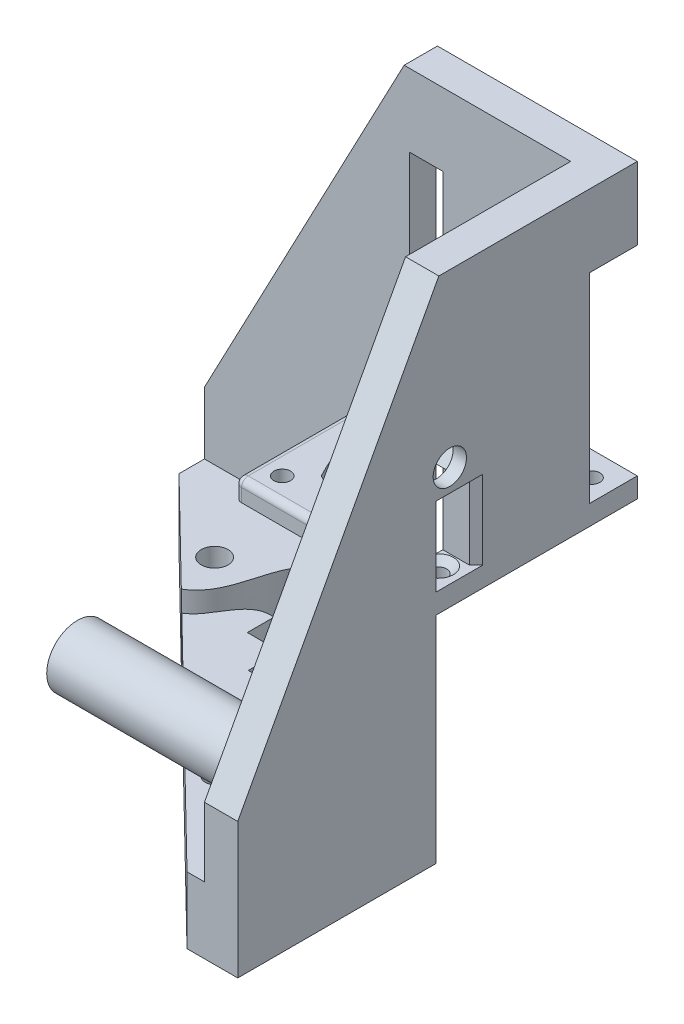
from build123d import *

# Parameters (mm, degrees)
SKETCH1_R                      = 1.560106864
SKETCH1_R_2                    = 2.009221825
BOSS_EXTRUDE1_DEPTH            = 10
BOSS_EXTRUDE3_START            = -10
BOSS_EXTRUDE3_DEPTH            = 76.2
CUT_EXTRUDE1_REACH             = 89.478
SKETCH4_W                      = 29.21
SKETCH4_H                      = 29.21
CUT_EXTRUDE1_DIRECTION_2_DEPTH = 22.3
CUT_EXTRUDE2_START             = -3
SKETCH5_W                      = 6.21
SKETCH5_H                      = 5
SKETCH5_W_2                    = 5
SKETCH5_H_2                    = 6.21
CUT_EXTRUDE2_DEPTH             = 30
CUT_EXTRUDE3_REACH             = 74.091
SKETCH6_R                      = 1.25
CHAMFER1_SIZE                  = 1
CUT_EXTRUDE4_REACH             = 102.097
CUT_EXTRUDE5_REACH             = 106.467
SKETCH9_R                      = 1.25
BOSS_EXTRUDE4_DEPTH            = 3
FILLET2_R                      = 1
SKETCH10_R                     = 11.5
CUT_EXTRUDE6_DEPTH             = 3
SKETCH12_R                     = 4.6
SKETCH12_R_2                   = 2.6
BOSS_EXTRUDE5_DEPTH            = 30
FILLET3_R                      = 1
CHAMFER2_SIZE                  = 1
BOSS_EXTRUDE6_REACH            = 109.184
SKETCH14_W                     = 12.395863616
SKETCH14_H                     = 18.726756054
SKETCH13_R                     = 2.5
CUT_EXTRUDE7_DEPTH             = 20
CUT_EXTRUDE8_DEPTH             = 3
CUT_EXTRUDE11_DEPTH            = 10
BOSS_EXTRUDE8_DEPTH            = 3


with BuildPart() as part:
    # Sketch1 → Boss-Extrude1 (new body)
    with BuildSketch(Plane(origin=(0, 0, 0), x_dir=(1, 0, 0), z_dir=(0, 1, 0))):
        Polygon((-34.466315789, 14.371052632), (-34.466315789, 5.547894737), (17.913684211, -45.628947368), (25.533684211, -45.628947368), (25.533684211, 14.371052632), align=None)
        with Locations(Location((7.652084211, -31.069547368, 0), (0, 0, 270))):
            Circle(SKETCH1_R, mode=Mode.SUBTRACT)
        with Locations(Location((-20.922915789, -2.646947368, 0), (0, 0, 270))):
            Circle(SKETCH1_R_2, mode=Mode.SUBTRACT)
    extrude(amount=BOSS_EXTRUDE1_DEPTH)

    # Sketch3 → Boss-Extrude3 (add)
    with BuildSketch(Plane(origin=(0, 10, 0), x_dir=(1, 0, 0), z_dir=(0, 1, 0)).offset(BOSS_EXTRUDE3_START)):
        Polygon((-34.466315789, 14.371052632), (-34.466315789, 9.371052632), (20.533684211, 9.371052632), (20.533684211, -45.628947368), (25.533684211, -45.628947368), (25.533684211, 14.371052632), align=None)
    extrude(amount=BOSS_EXTRUDE3_DEPTH)

    # Sketch4 → Cut-Extrude1 (cut, up to next)
    with BuildSketch(Plane(origin=(0, 10, 0), x_dir=(1, 0, 0), z_dir=(0, 1, 0)), mode=Mode.PRIVATE) as cut_extrude1_sk1:
        with Locations((10.928684211, -0.233947368)):
            Rectangle(SKETCH4_W, SKETCH4_H)
    cut_extrude1_tool1 = extrude(cut_extrude1_sk1.sketch, amount=-CUT_EXTRUDE1_REACH, mode=Mode.PRIVATE) & part.part
    add(cut_extrude1_tool1.solids().sort_by_distance((10.928684, 10, 0.233947))[0], mode=Mode.SUBTRACT)

    # Sketch4 → Cut-Extrude1 direction 2 (cut)
    with BuildSketch(Plane(origin=(0, 10, 0), x_dir=(1, 0, 0), z_dir=(0, 1, 0))):
        with Locations((10.928684211, -0.233947368)):
            Rectangle(SKETCH4_W, SKETCH4_H)
    extrude(amount=CUT_EXTRUDE1_DIRECTION_2_DEPTH, mode=Mode.SUBTRACT)

    # Sketch5 → Cut-Extrude2 (cut)
    with BuildSketch(Plane.XZ.offset(-32.3).offset(CUT_EXTRUDE2_START)):
        with Locations((22.428684211, 12.338947368)):
            Rectangle(SKETCH5_W, SKETCH5_H)
        with Locations((-1.176315789, -11.266052632)):
            Rectangle(SKETCH5_W_2, SKETCH5_H_2)
        with Locations((22.428684211, -11.266052632)):
            Rectangle(SKETCH5_W, SKETCH5_H_2)
    extrude(amount=-CUT_EXTRUDE2_DEPTH, mode=Mode.SUBTRACT)

    # Sketch6 → Cut-Extrude3 (cut, up to next)
    with BuildSketch(Plane.XZ.offset(-32.3), mode=Mode.PRIVATE) as cut_extrude3_sk1:
        with Locations(Location((22.323684211, 12.288947368, 0), (0, 0, 270))):
            Circle(SKETCH6_R)
    cut_extrude3_tool1 = extrude(cut_extrude3_sk1.sketch, amount=-CUT_EXTRUDE3_REACH, mode=Mode.PRIVATE) & part.part
    # Sketch6 → Cut-Extrude3 (cut, up to next)
    with BuildSketch(Plane.XZ.offset(-32.3), mode=Mode.PRIVATE) as cut_extrude3_sk2:
        with Locations(Location((22.323684211, -10.711052632, 0), (0, 0, 270))):
            Circle(SKETCH6_R)
    cut_extrude3_tool2 = extrude(cut_extrude3_sk2.sketch, amount=-CUT_EXTRUDE3_REACH, mode=Mode.PRIVATE) & part.part
    # Sketch6 → Cut-Extrude3 (cut, up to next)
    with BuildSketch(Plane.XZ.offset(-32.3), mode=Mode.PRIVATE) as cut_extrude3_sk3:
        with Locations(Location((-0.676315789, -10.711052632, 0), (0, 0, 270))):
            Circle(SKETCH6_R)
    cut_extrude3_tool3 = extrude(cut_extrude3_sk3.sketch, amount=-CUT_EXTRUDE3_REACH, mode=Mode.PRIVATE) & part.part
    add(cut_extrude3_tool1.solids().sort_by_distance((22.323684, 32.3, 12.288947))[0], mode=Mode.SUBTRACT)
    add(cut_extrude3_tool2.solids().sort_by_distance((22.323684, 32.3, -10.711053))[0], mode=Mode.SUBTRACT)
    add(cut_extrude3_tool3.solids().sort_by_distance((-0.676316, 32.3, -10.711053))[0], mode=Mode.SUBTRACT)

    # Chamfer1
    chamfer1_edges = [part.edges().sort_by_distance(p)[0] for p in [
        (19.323684211, 50.3, -14.371052632),
        (25.533684211, 50.3, -8.161052632),
        (-3.676315789, 50.3, -14.371052632),
        (1.323684211, 50.3, -14.371052632),
        (25.533684211, 16.15, 14.838947368),
        (-3.676315789, 16.15, -14.371052632),
        (25.533684211, 50.3, 9.838947368),
        (25.533684211, 50.3, 14.838947368),
    ]]
    chamfer(chamfer1_edges, length=CHAMFER1_SIZE)

    # Sketch7 → Cut-Extrude4 (cut, up to next)
    with BuildSketch(Plane.XY.offset(-9.371052632), mode=Mode.PRIVATE) as cut_extrude4_sk1:
        Polygon((-4.478138481, 76.2), (-34.466315789, 19.345490892), (-34.466315789, 76.2), align=None)
    cut_extrude4_tool1 = extrude(cut_extrude4_sk1.sketch, amount=-CUT_EXTRUDE4_REACH, mode=Mode.PRIVATE) & part.part
    add(cut_extrude4_tool1.solids().sort_by_distance((-24.470257, 57.248497, -9.371053))[0], mode=Mode.SUBTRACT)

    # Sketch8 → Cut-Extrude5 (cut, up to next)
    with BuildSketch(Plane.ZY.offset(-20.533684211), mode=Mode.PRIVATE) as cut_extrude5_sk1:
        Polygon((45.628947368, 76.2), (15.432121686, 76.2), (45.628947368, 20.360875822), align=None)
    cut_extrude5_tool1 = extrude(cut_extrude5_sk1.sketch, amount=-CUT_EXTRUDE5_REACH, mode=Mode.PRIVATE) & part.part
    add(cut_extrude5_tool1.solids().sort_by_distance((20.533684, 57.586959, 35.563339))[0], mode=Mode.SUBTRACT)

    # Sketch9 → Boss-Extrude4 (add)
    with BuildSketch(Plane.XZ.offset(-32.3)):
        with BuildLine():
            Line((-4.676315789, 15.838947368), (-4.676315789, -14.371052632))
            Line((-4.676315789, -14.371052632), (0.900761385, -14.371052632))
            ThreePointArc((0.900761385, -14.371052632), (0.366362818, -13.109171958), (-0.102099011, -11.821356685))
            ThreePointArc((-0.102099011, -11.821356685), (-1.878735883, -11.052645838), (-0.771600032, -9.464689557))
            ThreePointArc((-0.771600032, -9.464689557), (-1.228222209, 0.185593043), (1.804207587, 9.358423992))
            ThreePointArc((1.804207587, 9.358423992), (11.255772005, 12.427491579), (21.173303455, 11.799944181))
            ThreePointArc((21.173303455, 11.799944181), (22.678913505, 13.487409779), (23.021780943, 11.252047686))
            ThreePointArc((23.021780943, 11.252047686), (24.290349599, 10.788966069), (25.533684211, 10.261870194))
            Line((25.533684211, 10.261870194), (25.533684211, 15.838947368))
            Line((25.533684211, 15.838947368), (-4.676315789, 15.838947368))
        make_face()
        with Locations(Location((-1.126315789, 12.288947368, 0), (0, 0, 270))):
            Circle(SKETCH9_R, mode=Mode.SUBTRACT)
    extrude(amount=-BOSS_EXTRUDE4_DEPTH)

    # Fillet2
    fillet2_edges = [part.edges().sort_by_distance(p)[0] for p in [
        (7.928684211, 35.3, 15.838947368),
        (-4.676315789, 35.3, 3.233947368),
        (-4.676315789, 33.8, 15.838947368),
        (-0.793400855, 33.8, -9.371052632),
    ]]
    fillet(fillet2_edges, radius=FILLET2_R)

    # Sketch10 → Cut-Extrude6 (cut)
    with BuildSketch(Plane.XZ.offset(-32.3)):
        with Locations((10.823684211, 0.788947368)):
            Circle(SKETCH10_R)
    extrude(amount=-CUT_EXTRUDE6_DEPTH, mode=Mode.SUBTRACT)

    # Sketch12 → Boss-Extrude5 (add)
    with BuildSketch(Plane.ZY.offset(-20.533684211)):
        with Locations(Location((34.718947368, 18.95, 0), (0, 0, 180))):
            Circle(SKETCH12_R)
        with Locations((34.718947368, 18.95)):
            Circle(SKETCH12_R_2, mode=Mode.SUBTRACT)
    extrude(amount=BOSS_EXTRUDE5_DEPTH)

    # Fillet3
    fillet3_edges = [part.edges().sort_by_distance(p)[0] for p in [
        (-9.466315789, 18.95, 32.118947368),
    ]]
    fillet(fillet3_edges, radius=FILLET3_R)

    # Chamfer2
    # the kernel refuses this chamfer: 1 mm, written as the material it takes off along each edge
    with BuildSketch(Plane(origin=(22.323684211, 35.3, 12.288947368), x_dir=(-0.9203046044214335, 0, -0.3912025499414705), z_dir=(0.3912025499414705, 0, -0.9203046044214335))) as chamfer2_piece_1:
        Polygon((1.25 + CHAMFER2_SIZE, 0), (1.25, -CHAMFER2_SIZE), (1.25, 0), align=None)
    revolve(axis=Axis((22.323684211, 35.3, 12.288947368), (0, 1, 0)), revolution_arc=259.078782156, mode=Mode.SUBTRACT)
    with BuildSketch(Plane(origin=(-0.676315789, 35.3, -10.711052632), x_dir=(0, 0, -1), z_dir=(-1, 0, 0))) as chamfer2_piece_2_section:
        Polygon((1.25 + CHAMFER2_SIZE, 0), (1.25, CHAMFER2_SIZE), (1.25, 0), align=None)
    chamfer2_piece_2 = revolve(axis=Axis((-0.676315789, 35.3, -10.711052632), (0, -1, 0)), mode=Mode.PRIVATE)
    chamfer2_piece_2 = split(chamfer2_piece_2, bisect_by=Plane(origin=(1.323684211, 34.812414485, -8.973467116), z_dir=(-1, 0, 0)), keep=Keep.TOP, mode=Mode.PRIVATE)
    add(chamfer2_piece_2, mode=Mode.SUBTRACT)
    with BuildSketch(Plane(origin=(22.323684211, 35.3, 12.288947368), x_dir=(-0.920304604421433, 0, -0.39120254994147174), z_dir=(-0.39120254994147174, 0, 0.920304604421433))) as chamfer2_piece_3:
        Polygon((1.25 + CHAMFER2_SIZE, 0), (1.25, CHAMFER2_SIZE), (1.25, 0), align=None)
    revolve(axis=Axis((22.323684211, 35.3, 12.288947368), (0, -1, 0)), revolution_arc=66.970653716, mode=Mode.SUBTRACT)
    with BuildSketch(Plane(origin=(22.323684211, 35.3, 12.288947368), x_dir=(0, 0, -1), z_dir=(-1, 0, 0))) as chamfer2_piece_4:
        Polygon((1.25 + CHAMFER2_SIZE, 0), (1.25, CHAMFER2_SIZE), (1.25, 0), align=None)
    revolve(axis=Axis((22.323684211, 35.3, 12.288947368), (0, -1, 0)), revolution_arc=33.950564129, mode=Mode.SUBTRACT)

    # Boss-Extrude6: up to this face of the body (flat: up to its plane)
    boss_extrude6_end = Plane(part.part.faces().sort_by_distance((20.533684211, 43.280549831, 15.597165562))[0])
    # Sketch14 → Boss-Extrude6 (add, up to the picked face)
    with BuildSketch(Plane(origin=(25.533684211, 0, 0), x_dir=(0, 0, -1), z_dir=(1, 0, 0)), mode=Mode.PRIVATE) as boss_extrude6_sk1:
        with Locations((-13.255996287, 56.485629394)):
            Rectangle(SKETCH14_W, SKETCH14_H)
    boss_extrude6_tool1 = split(extrude(boss_extrude6_sk1.sketch, amount=-BOSS_EXTRUDE6_REACH, mode=Mode.PRIVATE), bisect_by=boss_extrude6_end, keep=Keep.BOTH, mode=Mode.PRIVATE)
    add(boss_extrude6_tool1.solids().sort_by(Axis((25.533684, 56.485629, 13.255996), (-1, 0, 0)))[0])

    # Sketch13 → Cut-Extrude7 (cut)
    with BuildSketch(Plane(origin=(25.533684211, 0, 0), x_dir=(0, 0, -1), z_dir=(1, 0, 0))):
        with Locations((-13.782947368, 50.506)):
            Circle(SKETCH13_R)
    extrude(amount=-CUT_EXTRUDE7_DEPTH, mode=Mode.SUBTRACT)

    # Sketch15 → Cut-Extrude8 (cut)
    with BuildSketch(Plane.ZY.offset(-20.533684211)):
        Polygon((16.150083472, 46.406), (18.517219576, 50.506), (16.150083472, 54.606), (11.415811265, 54.606), (9.048675161, 50.506), (11.415811265, 46.406), align=None)
    extrude(amount=-CUT_EXTRUDE8_DEPTH, mode=Mode.SUBTRACT)

    # Sketch19 → Cut-Extrude11 (cut)
    with BuildSketch(Plane(origin=(0, 10, 0), x_dir=(1, 0, 0), z_dir=(0, 1, 0))):
        Polygon((-3.676315789, 2.857670413), (-3.676315789, 7.517950593), (-8.676315789, 7.517950593), (-8.676315789, 5.124778841), (-8.676315789, -5.990338695), (-8.676315789, -9.982049407), (-3.676315789, -9.982049407), align=None)
        with BuildLine():
            Line((-8.676315789, -5.990338695), (-8.676315789, 5.124778841))
            add(Edge.make_bspline(
                [(-8.676315789, 5.124778841), (-16.808569573, 3.725426293), (-13.469663804, -5.736672492), (-19.282893487, -9.286767458)],
                knots=[0, 0, 0, 0, 1, 1, 1, 1], degree=3))
            Line((-19.282893487, -9.286767458), (-16.121145543, -12.375890698))
            add(Edge.make_bspline(
                [(-8.676315789, -5.990338695), (-12.90644661, -5.58199058), (-13.157452533, -10.60956316), (-16.121145543, -12.375890698)],
                knots=[0, 0, 0, 0, 1, 1, 1, 1], degree=3))
        make_face()
    extrude(amount=-CUT_EXTRUDE11_DEPTH, mode=Mode.SUBTRACT)

    # Sketch20 → Boss-Extrude8 (add)
    with BuildSketch(Plane.XZ):
        with BuildLine():
            add(Edge.make_bspline(
                [(-16.121145543, 12.375890698), (-14.069186941, 11.152946562), (-13.317608867, 8.366659728), (-11.645404629, 6.903612087)],
                knots=[0, 0, 0, 0, 0.692365436, 0.692365436, 0.692365436, 0.692365436], degree=3))
            Line((-16.121145543, 12.375890698), (-19.282893487, 9.286767458))
            add(Edge.make_bspline(
                [(-13.371318098, -2.196913004), (-15.640126217, 1.283314512), (-15.162227429, 6.77030817), (-19.282893487, 9.286767458)],
                knots=[0.291157191, 0.291157191, 0.291157191, 0.291157191, 1, 1, 1, 1], degree=3))
            Line((-13.371318098, -2.196913004), (-11.645404629, 6.903612087))
        make_face()
    extrude(amount=-BOSS_EXTRUDE8_DEPTH)


solid = part.part
